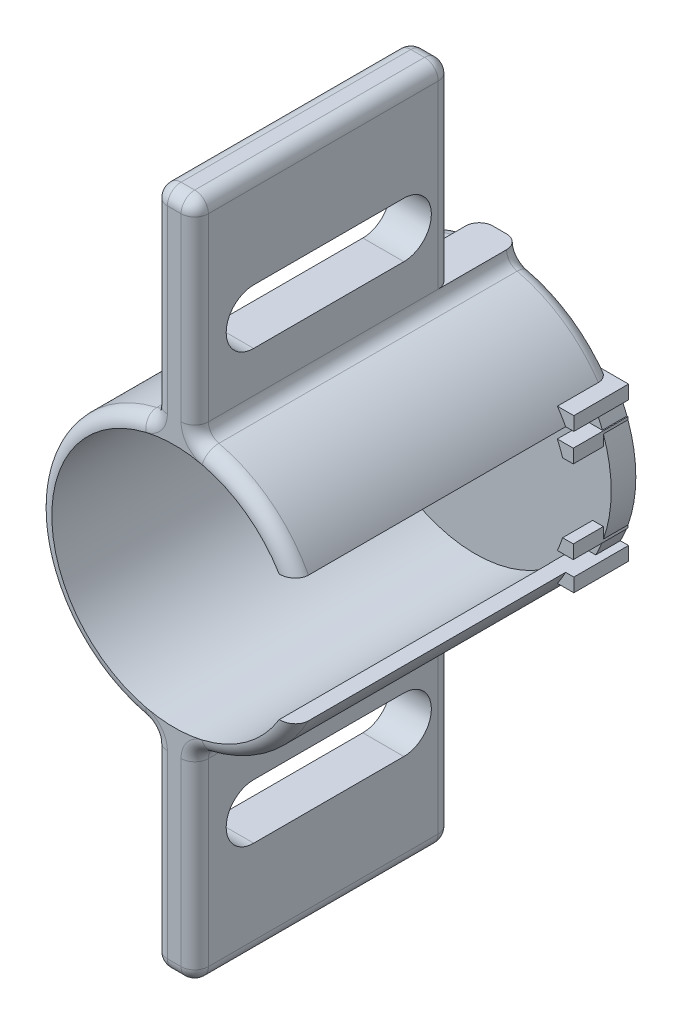
from build123d import *

# Parameters (mm, degrees)
BOSS_EXTRUDE1_DEPTH        = 2.286
BOSS_EXTRUDE2_DEPTH        = 2.794
BOSS_EXTRUDE3_DEPTH        = 27.94
BOSS_EXTRUDE4_DEPTH        = 15.113
FILLET1_R                  = 1.27
F_10_START                 = -1.905
F_10_CLEARANCE_SLOT1_DEPTH = 3.81
SKETCH9_W                  = 6.35
SKETCH9_H                  = 18.002875112
CUT_EXTRUDE1_DEPTH         = 47.043123595
FILLET2_R                  = 1.27


# Read off the part's stored shape, not the designer's step: #10 Clearance Slot1
with BuildPart() as part:
    # Sketch1 → Boss-Extrude1 (new body)
    with BuildSketch(Plane.XY):
        with BuildLine():
            Line((10.43608705, 7.12525223), (11.96008705, 7.12525223))
            Line((11.96008705, 7.12525223), (11.96008705, 5.85525223))
            Line((11.96008705, 5.85525223), (11.19808705, 5.85525223))
            ThreePointArc((11.19808705, 5.85525223), (11.526619723, 5.178626266), (11.814313138, 4.48365223))
            Line((11.814313138, 4.48365223), (11.908293138, 4.48365223))
            Line((11.908293138, 4.48365223), (11.908293138, 4.227728324))
            ThreePointArc((11.908293138, 4.227728324), (12.6365, 0), (11.908293138, -4.227728324))
            Line((11.908293138, -4.227728324), (11.908293138, -4.48365223))
            Line((11.908293138, -4.48365223), (11.814313138, -4.48365223))
            ThreePointArc((11.814313138, -4.48365223), (11.526619723, -5.178626266), (11.19808705, -5.85525223))
            Line((11.19808705, -5.85525223), (11.96008705, -5.85525223))
            Line((11.96008705, -5.85525223), (11.96008705, -7.12525223))
            Line((11.96008705, -7.12525223), (10.43608705, -7.12525223))
            ThreePointArc((10.43608705, -7.12525223), (8.963495738, -8.907125036), (7.190948519, -10.390928334))
            ThreePointArc((7.190948519, -10.390928334), (0.124386606, -12.635887789), (-6.985, -10.530475167))
            ThreePointArc((-6.985, -10.530475167), (-12.628106428, 0.460500059), (-6.199452951, 11.011263114))
            ThreePointArc((-6.199452951, 11.011263114), (0.920388359, 12.602936861), (7.733442071, 9.993748345))
            ThreePointArc((7.733442071, 9.993748345), (9.197283002, 8.66551312), (10.43608705, 7.12525223))
        make_face()
    extrude(amount=BOSS_EXTRUDE1_DEPTH)

    # Sketch2 → Boss-Extrude2 (add)
    with BuildSketch(Plane.XY.offset(2.286)):
        with BuildLine():
            Line((8.78508705, 7.12525223), (11.96008705, 7.12525223))
            Line((11.96008705, 7.12525223), (11.96008705, 5.85525223))
            Line((11.96008705, 5.85525223), (9.72742705, 5.85525223))
            ThreePointArc((9.72742705, 5.85525223), (9.276143682, 6.505008111), (8.78508705, 7.12525223))
        make_face()
        with BuildLine():
            Line((10.424933138, 4.48365223), (11.908293138, 4.48365223))
            Line((11.908293138, 4.48365223), (11.908293138, 3.21365223))
            Line((11.908293138, 3.21365223), (10.917693138, 3.21365223))
            ThreePointArc((10.917693138, 3.21365223), (10.688439222, 3.85529715), (10.424933138, 4.48365223))
        make_face()
        with BuildLine():
            Line((11.908293138, -3.21365223), (10.917693138, -3.21365223))
            ThreePointArc((10.917693138, -3.21365223), (10.688439222, -3.85529715), (10.424933138, -4.48365223))
            Line((10.424933138, -4.48365223), (11.908293138, -4.48365223))
            Line((11.908293138, -4.48365223), (11.908293138, -3.21365223))
        make_face()
        with BuildLine():
            Line((11.96008705, -5.85525223), (9.72742705, -5.85525223))
            ThreePointArc((9.72742705, -5.85525223), (9.276143682, -6.505008111), (8.78508705, -7.12525223))
            Line((8.78508705, -7.12525223), (11.96008705, -7.12525223))
            Line((11.96008705, -7.12525223), (11.96008705, -5.85525223))
        make_face()
    extrude(amount=BOSS_EXTRUDE2_DEPTH)

    # Sketch3 → Boss-Extrude3 (add)
    with BuildSketch(Plane.XY.offset(2.286)):
        with BuildLine():
            Line((11.19808705, 5.85525223), (9.74234795, 5.85525223))
            ThreePointArc((9.74234795, 5.85525223), (-11.3665, 0), (9.74234795, -5.85525223))
            Line((9.74234795, -5.85525223), (11.19808705, -5.85525223))
            ThreePointArc((11.19808705, -5.85525223), (-12.6365, 0), (11.19808705, 5.85525223))
        make_face()
    extrude(amount=BOSS_EXTRUDE3_DEPTH)

    # Sketch4 → Boss-Extrude4 (add, symmetric)
    with BuildSketch(Plane.XY.offset(15.113)):
        with BuildLine():
            Line((-1.905, -12.492081782), (-1.905, -31.542081782))
            Line((-1.905, -31.542081782), (1.905, -31.542081782))
            Line((1.905, -31.542081782), (1.905, -12.492081782))
            ThreePointArc((1.905, -12.492081782), (0, -12.6365), (-1.905, -12.492081782))
        make_face()
        with BuildLine():
            Line((1.905, 31.542081782), (1.905, 12.492081782))
            ThreePointArc((1.905, 12.492081782), (0, 12.6365), (-1.905, 12.492081782))
            Line((-1.905, 12.492081782), (-1.905, 31.542081782))
            Line((-1.905, 31.542081782), (1.905, 31.542081782))
        make_face()
    extrude(amount=BOSS_EXTRUDE4_DEPTH, both=True)

    # Fillet1
    fillet1_edges = [part.edges().sort_by_distance(p)[0] for p in [
        (7.344017918, 10.283313331, 30.226),
        (-12.6365, 0, 30.226),
        (-12.6365, 0, 0),
        (6.728768257, 10.696018418, 0),
        (1.905, -22.017081782, 0),
        (1.905, -22.017081782, 30.226),
        (-1.905, -22.017081782, 0),
        (-1.905, -22.017081782, 30.226),
        (-1.905, -31.542081782, 15.113),
        (0, -31.542081782, 30.226),
        (1.905, -31.542081782, 15.113),
        (-1.905, -12.492081782, 15.113),
        (1.905, -12.492081782, 15.113),
        (-1.905, 22.017081782, 0),
        (-1.905, 22.017081782, 30.226),
        (1.905, 12.492081782, 15.113),
        (1.905, 31.542081782, 15.113),
        (0, 31.542081782, 0),
        (0, 31.542081782, 30.226),
        (-1.905, 31.542081782, 15.113),
        (-1.905, 12.492081782, 15.113),
        (6.728768257, -10.696018418, 0),
        (7.344017918, -10.283313331, 30.226),
        (1.905, 22.017081782, 0),
        (1.905, 22.017081782, 30.226),
    ]]
    fillet(fillet1_edges, radius=FILLET1_R - 0.0001)  # a hair under: the kernel refuses the full size

    # #10 Clearance Slot1 outline → #10 Clearance Slot1 (cut)
    with BuildSketch(Plane.YZ.offset(F_10_START)):
        with BuildLine():
            ThreePointArc((-22.447524785, 10.8077), (-19.894824785, 8.255), (-17.342124785, 10.8077))
            Line((-17.342124785, 10.8077), (-17.342124785, 24.7523))
            ThreePointArc((-17.342124785, 24.7523), (-19.894824785, 27.305), (-22.447524785, 24.7523))
            Line((-22.447524785, 24.7523), (-22.447524785, 10.8077))
        make_face()
        with BuildLine():
            Line((17.342124785, 24.7523), (17.342124785, 10.8077))
            ThreePointArc((17.342124785, 10.8077), (19.894824785, 8.255), (22.447524785, 10.8077))
            Line((22.447524785, 10.8077), (22.447524785, 24.7523))
            ThreePointArc((22.447524785, 24.7523), (19.894824785, 27.305), (17.342124785, 24.7523))
        make_face()
    extrude(amount=F_10_CLEARANCE_SLOT1_DEPTH, mode=Mode.SUBTRACT)

    # Sketch9 → Cut-Extrude1 (cut, through all)
    with BuildSketch(Plane(origin=(1.905, 0, 0), x_dir=(0, 0, -1), z_dir=(1, 0, 0))):
        with Locations((-3.175, -22.540644226)):
            Rectangle(SKETCH9_W, SKETCH9_H)
        with Locations((-3.175, 22.540644226)):
            Rectangle(SKETCH9_W, SKETCH9_H)
    extrude(amount=-CUT_EXTRUDE1_DEPTH, mode=Mode.SUBTRACT)

    # Fillet2
    fillet2_edges = [part.edges().sort_by_distance(p)[0] for p in [
        (1.905, -21.905694226, 6.35),
        (1.533054901, -31.170136684, 6.35),
        (-1.905, -21.905694226, 6.35),
        (0, -31.542081782, 6.35),
        (-1.533054901, -31.170136684, 6.35),
        (1.533054901, 31.170136684, 6.35),
        (-1.905, 21.905694226, 6.35),
        (-1.533054901, 31.170136684, 6.35),
        (0, 31.542081782, 6.35),
        (1.905, 21.905694226, 6.35),
    ]]
    fillet(fillet2_edges, radius=FILLET2_R - 0.0001)  # a hair under: the kernel refuses the full size


solid = part.part
